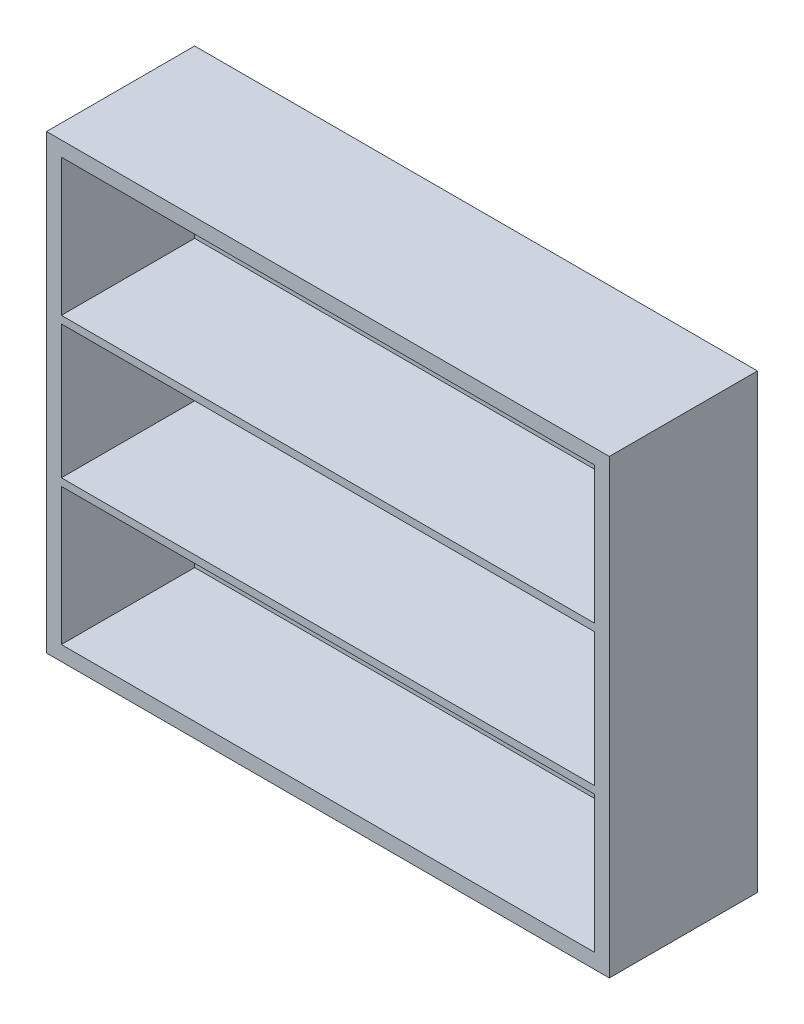
from build123d import *

# Parameters (mm, degrees)
ESQUISSE1_W             = 76
ESQUISSE1_H             = 61
BOSS_EXTRU_1_DEPTH      = 20
ESQUISSE2_W             = 72
ESQUISSE2_H             = 18.5
ESQUISSE2_H_2           = 18
ENL_V_MAT_EXTRU_1_DEPTH = 18
ENL_V_MAT_EXTRU_2_REACH = 101.101
ESQUISSE3_R             = 2


with BuildPart() as part:
    # Esquisse1 → Boss.-Extru.1 (new body)
    with BuildSketch(Plane.XY):
        with Locations((38, 30.5)):
            Rectangle(ESQUISSE1_W, ESQUISSE1_H)
    extrude(amount=-BOSS_EXTRU_1_DEPTH)

    # Esquisse2 → Enlèv. mat.-Extru.1 (cut)
    with BuildSketch(Plane.XY):
        with Locations((38, 11.25)):
            Rectangle(ESQUISSE2_W, ESQUISSE2_H)
        with Locations((38, 49.75)):
            Rectangle(ESQUISSE2_W, ESQUISSE2_H)
        with Locations((38, 30.5)):
            Rectangle(ESQUISSE2_W, ESQUISSE2_H_2)
    extrude(amount=-ENL_V_MAT_EXTRU_1_DEPTH, mode=Mode.SUBTRACT)

    # Esquisse3 → Enlèv. mat.-Extru.2 (cut, up to next)
    with BuildSketch(Plane.XY.offset(-18), mode=Mode.PRIVATE) as enl_v_mat_extru_2_sk1:
        with Locations((38, 49.75)):
            Circle(ESQUISSE3_R)
    enl_v_mat_extru_2_tool1 = extrude(enl_v_mat_extru_2_sk1.sketch, amount=-ENL_V_MAT_EXTRU_2_REACH, mode=Mode.PRIVATE) & part.part
    # Esquisse3 → Enlèv. mat.-Extru.2 (cut, up to next)
    with BuildSketch(Plane.XY.offset(-18), mode=Mode.PRIVATE) as enl_v_mat_extru_2_sk2:
        with Locations((38, 11.25)):
            Circle(ESQUISSE3_R)
    enl_v_mat_extru_2_tool2 = extrude(enl_v_mat_extru_2_sk2.sketch, amount=-ENL_V_MAT_EXTRU_2_REACH, mode=Mode.PRIVATE) & part.part
    add(enl_v_mat_extru_2_tool1.solids().sort_by_distance((38, 49.75, -18))[0], mode=Mode.SUBTRACT)
    add(enl_v_mat_extru_2_tool2.solids().sort_by_distance((38, 11.25, -18))[0], mode=Mode.SUBTRACT)


solid = part.part
